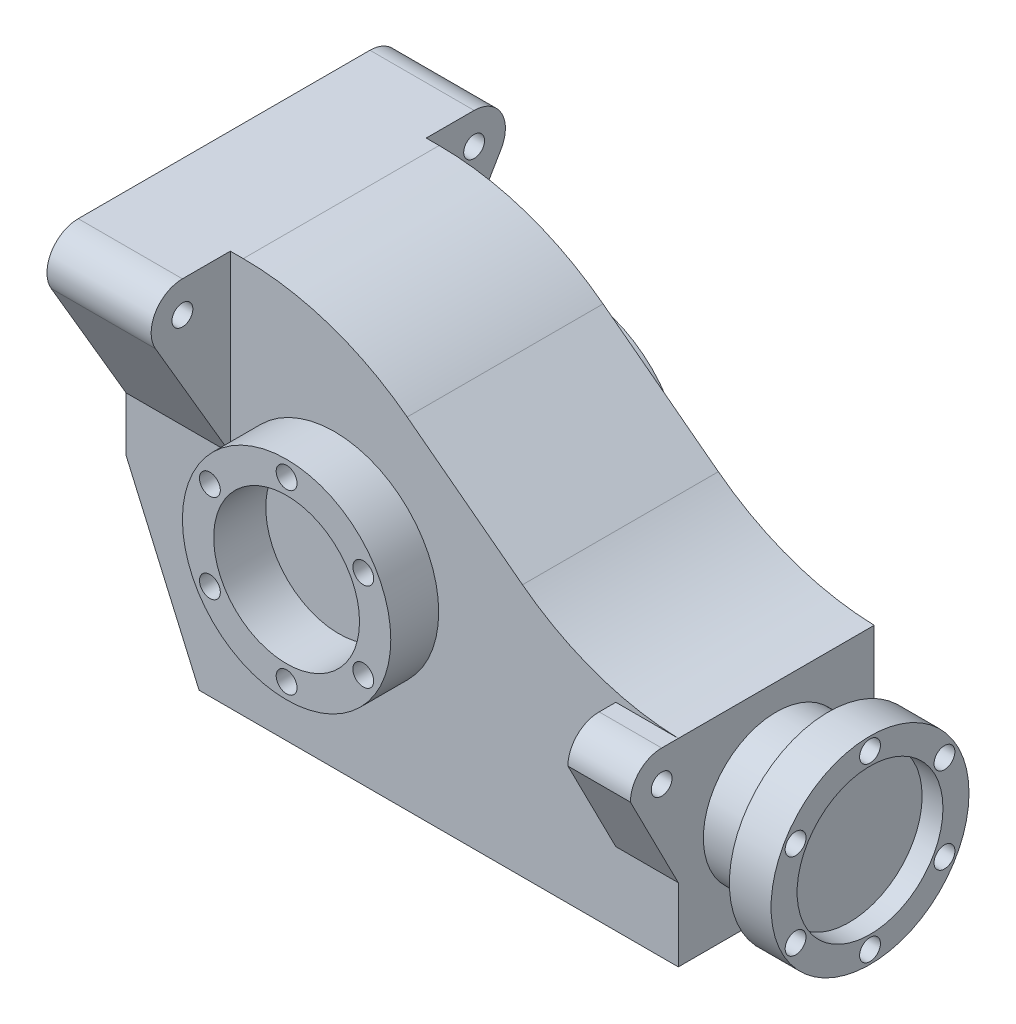
from build123d import *

# Parameters (mm, degrees)
DODANIE_WYCI_GNI_CIE1_DEPTH = 47
SZKIC2_R                    = 35
DODANIE_WYCI_GNI_CIE2_DEPTH = 25
SZKIC3_R                    = 47.5
DODANIE_WYCI_GNI_CIE3_DEPTH = 20
SZKIC7_R                    = 50
DODANIE_WYCI_GNI_CIE5_DEPTH = 23
SZKIC8_R                    = 35
WYTNIJ_WYCI_GNI_CIE1_DEPTH  = 25
SZKIC9_R                    = 5
WYTNIJ_WYCI_GNI_CIE2_DEPTH  = 15
SZKIC12_R                   = 5
DODANIE_WYCI_GNI_CIE6_DEPTH = 50
ZAOKR_GLENIE2_R             = 130
ZAOKR_GLENIE3_R             = 130
SZKIC4_R                    = 35
WYTNIJ_WYCI_GNI_CIE3_DEPTH  = 10
WYTNIJ_WYCI_GNI_CIE4_DEPTH  = 30
WYTNIJ_WYCI_GNI_CIE6_DEPTH  = 30
SZKIC20_R                   = 5
WYTNIJ_WYCI_GNI_CIE7_DEPTH  = 30
SZKIC21_R                   = 5
WYTNIJ_WYCI_GNI_CIE8_DEPTH  = 10
SZYK_KO_OWY1_COUNT          = 6


with BuildPart() as part:
    # Szkic1 → Dodanie-wyciągnięcie1 (new, symmetric)
    with BuildSketch(Plane.XY):
        Polygon((-35, 190), (65, 190), (190, 95), (230, 95), (230, 0), (0, 0), (-35, 80), align=None)
    extrude(amount=DODANIE_WYCI_GNI_CIE1_DEPTH, both=True)

    # Szkic7 → Dodanie-wyciągnięcie5 (add)
    with BuildSketch(Plane.XY.offset(47)):
        with Locations((65, 90)):
            Circle(SZKIC7_R)
    dodanie_wyci_gni_cie5 = extrude(amount=DODANIE_WYCI_GNI_CIE5_DEPTH)

    # Szkic8 → Wytnij-wyciągnięcie1 (cut)
    with BuildSketch(Plane.XY.offset(70)):
        with Locations((65, 90)):
            Circle(SZKIC8_R)
    wytnij_wyci_gni_cie1 = extrude(amount=-WYTNIJ_WYCI_GNI_CIE1_DEPTH, mode=Mode.SUBTRACT)

    # Szkic9 → Wytnij-wyciągnięcie2 (cut)
    with BuildSketch(Plane.XY.offset(70)):
        with Locations((65, 132.5)):
            Circle(SZKIC9_R)
        with Locations((101.806079661, 111.25)):
            Circle(SZKIC9_R)
        with Locations((101.806079661, 68.75)):
            Circle(SZKIC9_R)
        with Locations((65, 47.5)):
            Circle(SZKIC9_R)
        with Locations((28.193920339, 68.75)):
            Circle(SZKIC9_R)
        with Locations((28.193920339, 111.25)):
            Circle(SZKIC9_R)
    wytnij_wyci_gni_cie2 = extrude(amount=-WYTNIJ_WYCI_GNI_CIE2_DEPTH, mode=Mode.SUBTRACT)

    # Szkic12 → Dodanie-wyciągnięcie6 (add)
    # profile 1 of 6: a face of its own
    with BuildSketch(Plane.ZY.offset(35)):
        with BuildLine():
            Line((-47, 190), (-70, 190))
            ThreePointArc((-70, 190), (-83.014439461, 182.458174409), (-82.941861244, 167.416582068))
            Line((-82.941861244, 167.416582068), (-47, 106.078200716))
            Line((-47, 106.078200716), (-47, 190))
        make_face()
        with Locations(Location((-70, 175, 0), (0, 0, 270))):
            Circle(SZKIC12_R, mode=Mode.SUBTRACT)
    # profile 2 of 6: a face of its own
    with BuildSketch(Plane.ZY.offset(35)):
        Polygon((0, 190), (-47, 190), (-47, 106.078200716), (-31.7192076, 80), (0, 80), align=None)
    # profile 3 of 6: a face of its own
    with BuildSketch(Plane.ZY.offset(35)):
        Polygon((47, 190), (0, 190), (0, 80), (31.7192076, 80), (47, 106.078200716), align=None)
    # profile 4 of 6: a face of its own
    with BuildSketch(Plane.ZY.offset(35)):
        with BuildLine():
            Line((70, 190), (47, 190))
            Line((47, 190), (47, 106.078200716))
            Line((47, 106.078200716), (82.941861244, 167.416582068))
            ThreePointArc((82.941861244, 167.416582068), (83.014439461, 182.458174409), (70, 190))
        make_face()
        with Locations(Location((70, 175, 0), (0, 0, 270))):
            Circle(SZKIC12_R, mode=Mode.SUBTRACT)
    # profile 5 of 6: a face of its own
    with BuildSketch(Plane.ZY.offset(35)):
        Polygon((31.7192076, 80), (0, 80), (0, 60), (20, 60), align=None)
    # profile 6 of 6: a face of its own
    with BuildSketch(Plane.ZY.offset(35)):
        Polygon((0, 60), (0, 80), (-31.7192076, 80), (-20, 60), align=None)
    extrude(amount=-DODANIE_WYCI_GNI_CIE6_DEPTH)

    # Lustro1: Dodanie-wyciągnięcie5, Wytnij-wyciągnięcie1, Wytnij-wyciągnięcie2 across plane
    add(dodanie_wyci_gni_cie5.mirror(Plane.XY))
    add(wytnij_wyci_gni_cie1.mirror(Plane.XY), mode=Mode.SUBTRACT)
    add(wytnij_wyci_gni_cie2.mirror(Plane.XY), mode=Mode.SUBTRACT)

    # Zaokrąglenie2
    zaokr_glenie2_edges = [part.edges().sort_by_distance(p)[0] for p in [
        (65, 190, 0),
    ]]
    fillet(zaokr_glenie2_edges, radius=ZAOKR_GLENIE2_R)

    # Zaokrąglenie3
    # the kernel refuses this fillet: 130 mm, written as the material it adds along each edge
    with BuildSketch(Plane(origin=(190, 95, 47), x_dir=(-0.7961621941231027, 0.6050832675335577, 0), z_dir=(0, 0, -1))) as zaokr_glenie3_piece_1:
        with BuildLine():
            CenterArc((43.698629651, 130), ZAOKR_GLENIE3_R, 234.470905265, 35.529094735)
            Line((-31.846487765, 24.203330701), (-33.357390113, 22.087397315))
            ThreePointArc((-33.357390113, 22.087397315), (-17.496460378, 10.031643646), (-1.573216496, -2.070021705))
            Line((-1.573216496, -2.070021705), (0, -2.6))
            Line((0, -2.6), (43.698629651, -2.6))
            Line((43.698629651, -2.6), (43.698629651, 0))
        make_face()
    extrude(amount=94)

    # Szkic13 → Wyciągnięcie po profilach1 section 0
    with BuildSketch(Plane.XY.offset(47)):
        with BuildLine():
            Line((230, 95), (200, 95))
            Line((200, 95), (200, 35))
            Line((200, 35), (230, 35))
            Line((230, 35), (230, 95))
        make_face()
    # Szkic14 → Wyciągnięcie po profilach1 section 1
    with BuildSketch(Plane.XY.offset(70)):
        with BuildLine():
            Line((200, 95), (230, 95))
            Line((230, 95), (230, 60))
            Line((230, 60), (200, 60))
            Line((200, 60), (200, 95))
        make_face()
    loft()

    # Szkic15 → Wytnij-wyciągnięcie4 (cut)
    with BuildSketch(Plane(origin=(230, 0, 0), x_dir=(0, 0, -1), z_dir=(1, 0, 0))):
        with BuildLine():
            Line((-70, 80), (-70, 95))
            Line((-70, 95), (-55, 95))
            ThreePointArc((-55, 95), (-65.606601718, 90.606601718), (-70, 80))
        make_face()
    extrude(amount=-WYTNIJ_WYCI_GNI_CIE4_DEPTH, mode=Mode.SUBTRACT)

    # Szkic19 → Wytnij-wyciągnięcie6 (cut)
    with BuildSketch(Plane(origin=(230, 0, 0), x_dir=(0, 0, -1), z_dir=(1, 0, 0))):
        Polygon((-70, 80), (-47, 35), (-70, 60), align=None)
    extrude(amount=-WYTNIJ_WYCI_GNI_CIE6_DEPTH, mode=Mode.SUBTRACT)

    # Szkic20 → Wytnij-wyciągnięcie7 (cut)
    with BuildSketch(Plane(origin=(230, 0, 0), x_dir=(0, 0, -1), z_dir=(1, 0, 0))):
        with Locations(Location((-55, 80, 0), (0, 0, 90))):
            Circle(SZKIC20_R)
    extrude(amount=-WYTNIJ_WYCI_GNI_CIE7_DEPTH, mode=Mode.SUBTRACT)


with BuildPart() as body_2:
    # Szkic2 → Dodanie-wyciągnięcie2 (new body)
    with BuildSketch(Plane(origin=(230, 0, 0), x_dir=(0, 0, -1), z_dir=(1, 0, 0))):
        with Locations((0, 47.5)):
            Circle(SZKIC2_R)
    extrude(amount=DODANIE_WYCI_GNI_CIE2_DEPTH)

    # Szkic3 → Dodanie-wyciągnięcie3 (add)
    with BuildSketch(Plane(origin=(255, 0, 0), x_dir=(0, 0, -1), z_dir=(1, 0, 0))):
        with Locations((0, 47.5)):
            Circle(SZKIC3_R)
    extrude(amount=DODANIE_WYCI_GNI_CIE3_DEPTH)

    # Szkic4 → Wytnij-wyciągnięcie3 (cut)
    with BuildSketch(Plane(origin=(275, 0, 0), x_dir=(0, 0, -1), z_dir=(1, 0, 0))):
        with Locations((0, 47.5)):
            Circle(SZKIC4_R)
    extrude(amount=-WYTNIJ_WYCI_GNI_CIE3_DEPTH, mode=Mode.SUBTRACT)

    # Szkic21 → Wytnij-wyciągnięcie8 (cut)
    with BuildSketch(Plane(origin=(275, 0, 0), x_dir=(0, 0, -1), z_dir=(1, 0, 0))):
        with Locations((0, 88.75)):
            Circle(SZKIC21_R)
    wytnij_wyci_gni_cie8 = extrude(amount=-WYTNIJ_WYCI_GNI_CIE8_DEPTH, mode=Mode.SUBTRACT)

    # Szyk kołowy1: Wytnij-wyciągnięcie8 ×6 about axis
    szyk_ko_owy1_axis = Axis((0, 47.5, 0), (1, 0, 0))
    for i in range(1, SZYK_KO_OWY1_COUNT):
        add(wytnij_wyci_gni_cie8.rotate(szyk_ko_owy1_axis, i * 360 / SZYK_KO_OWY1_COUNT), mode=Mode.SUBTRACT)


solid = Compound([part.part, body_2.part])
